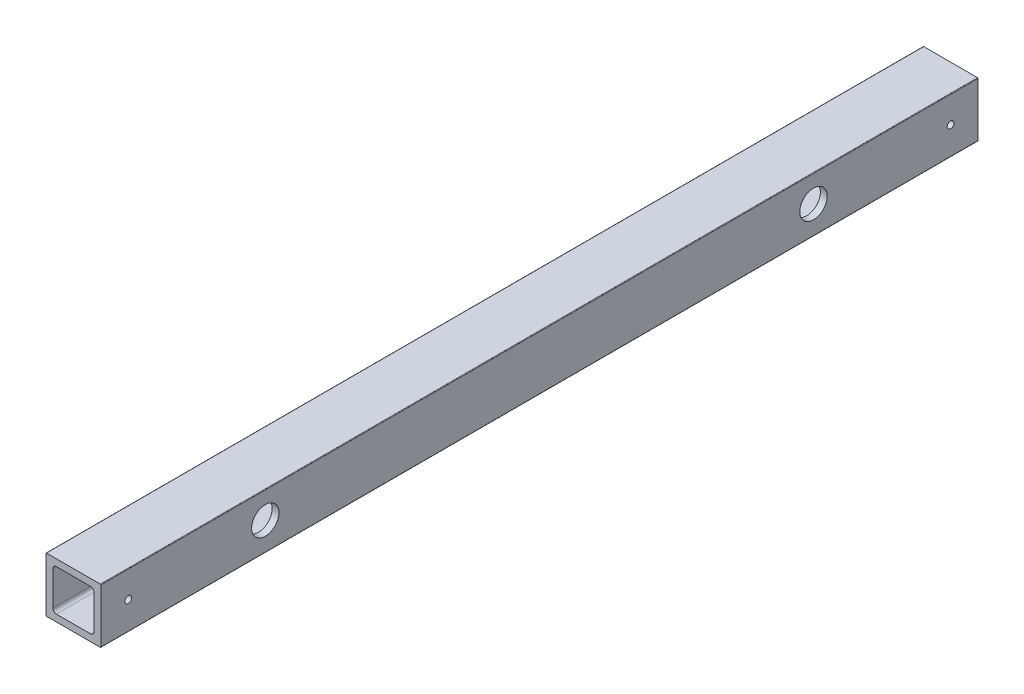
from build123d import *

# Parameters (mm, degrees)
BOSS_EXTRUDE1_DEPTH = 406.4
SKETCH2_R           = 1.5875
SKETCH2_R_2         = 6.35
CUT_EXTRUDE1_DEPTH  = 408.984411467


with BuildPart() as part:
    # Sketch1 → Boss-Extrude1 (new body)
    with BuildSketch(Plane(origin=(0, 0, 0), x_dir=(-1, 0, 0), z_dir=(0, 0, -1))):
        with BuildLine():
            Line((0, 0.254), (0, 25.146))
            ThreePointArc((0, 25.146), (-0.074394878, 25.325605122), (-0.254, 25.4))
            Line((-0.254, 25.4), (-25.146, 25.4))
            ThreePointArc((-25.146, 25.4), (-25.325605122, 25.325605122), (-25.4, 25.146))
            Line((-25.4, 25.146), (-25.4, 0.254))
            ThreePointArc((-25.4, 0.254), (-25.325605122, 0.074394878), (-25.146, 0))
            Line((-25.146, 0), (-0.254, 0))
            ThreePointArc((-0.254, 0), (-0.074394878, 0.074394878), (0, 0.254))
        make_face()
        with BuildLine():
            Line((-3.175, 20.6375), (-3.175, 4.7625))
            ThreePointArc((-3.175, 4.7625), (-3.639967985, 3.639967985), (-4.7625, 3.175))
            Line((-4.7625, 3.175), (-20.6375, 3.175))
            ThreePointArc((-20.6375, 3.175), (-21.760032015, 3.639967985), (-22.225, 4.7625))
            Line((-22.225, 4.7625), (-22.225, 20.6375))
            ThreePointArc((-22.225, 20.6375), (-21.760032015, 21.760032015), (-20.6375, 22.225))
            Line((-20.6375, 22.225), (-4.7625, 22.225))
            ThreePointArc((-4.7625, 22.225), (-3.639967985, 21.760032015), (-3.175, 20.6375))
        make_face(mode=Mode.SUBTRACT)
    extrude(amount=-BOSS_EXTRUDE1_DEPTH)

    # Sketch2 → Cut-Extrude1 (cut, through all)
    with BuildSketch(Plane.ZY):
        with Locations((12.697459746, 12.954)):
            Circle(SKETCH2_R)
        with Locations((393.7, 12.954)):
            Circle(SKETCH2_R)
        with Locations((76.2, 12.954)):
            Circle(SKETCH2_R_2)
        with Locations((330.2, 12.954)):
            Circle(SKETCH2_R_2)
    extrude(amount=-CUT_EXTRUDE1_DEPTH, mode=Mode.SUBTRACT)


solid = part.part
